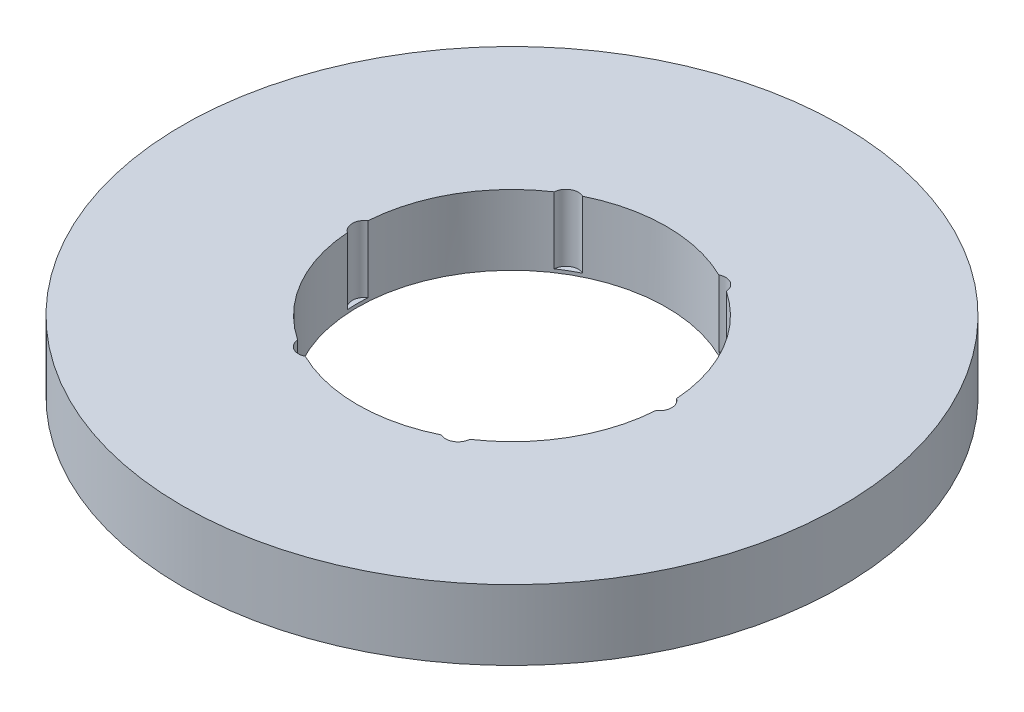
from build123d import *

# Parameters (mm, degrees)
SKETCH1_R           = 80
BOSS_EXTRUDE1_DEPTH = 17
SKETCH2_R           = 37.5
CUT_EXTRUDE1_DEPTH  = 115.407167608
SKETCH3_R           = 3.028065018
CUT_EXTRUDE2_DEPTH  = 16.188610835
CIRPATTERN1_COUNT   = 6


with BuildPart() as part:
    # Sketch1 → Boss-Extrude1 (new body)
    with BuildSketch(Plane(origin=(0, 0, 0), x_dir=(1, 0, 0), z_dir=(0, 1, 0))):
        Circle(SKETCH1_R)
    extrude(amount=BOSS_EXTRUDE1_DEPTH)

    # Sketch2 → Cut-Extrude1 (cut, through all)
    with BuildSketch(Plane(origin=(0, 0, 0), x_dir=(1, 0, 0), z_dir=(0, 1, 0))):
        Circle(SKETCH2_R)
    extrude(amount=CUT_EXTRUDE1_DEPTH, mode=Mode.SUBTRACT)

    # Sketch3 → Cut-Extrude2 (cut)
    with BuildSketch(Plane(origin=(0, 17, 0), x_dir=(1, 0, 0), z_dir=(0, 1, 0))):
        with Locations((-35.732773003, 0)):
            Circle(SKETCH3_R)
    cut_extrude2 = extrude(amount=-CUT_EXTRUDE2_DEPTH, mode=Mode.SUBTRACT)

    # CirPattern1: Cut-Extrude2 ×6 about axis
    cirpattern1_axis = Axis((0, 0, 0), (0, 1, 0))
    for i in range(1, CIRPATTERN1_COUNT):
        add(cut_extrude2.rotate(cirpattern1_axis, i * 360 / CIRPATTERN1_COUNT), mode=Mode.SUBTRACT)


solid = part.part
